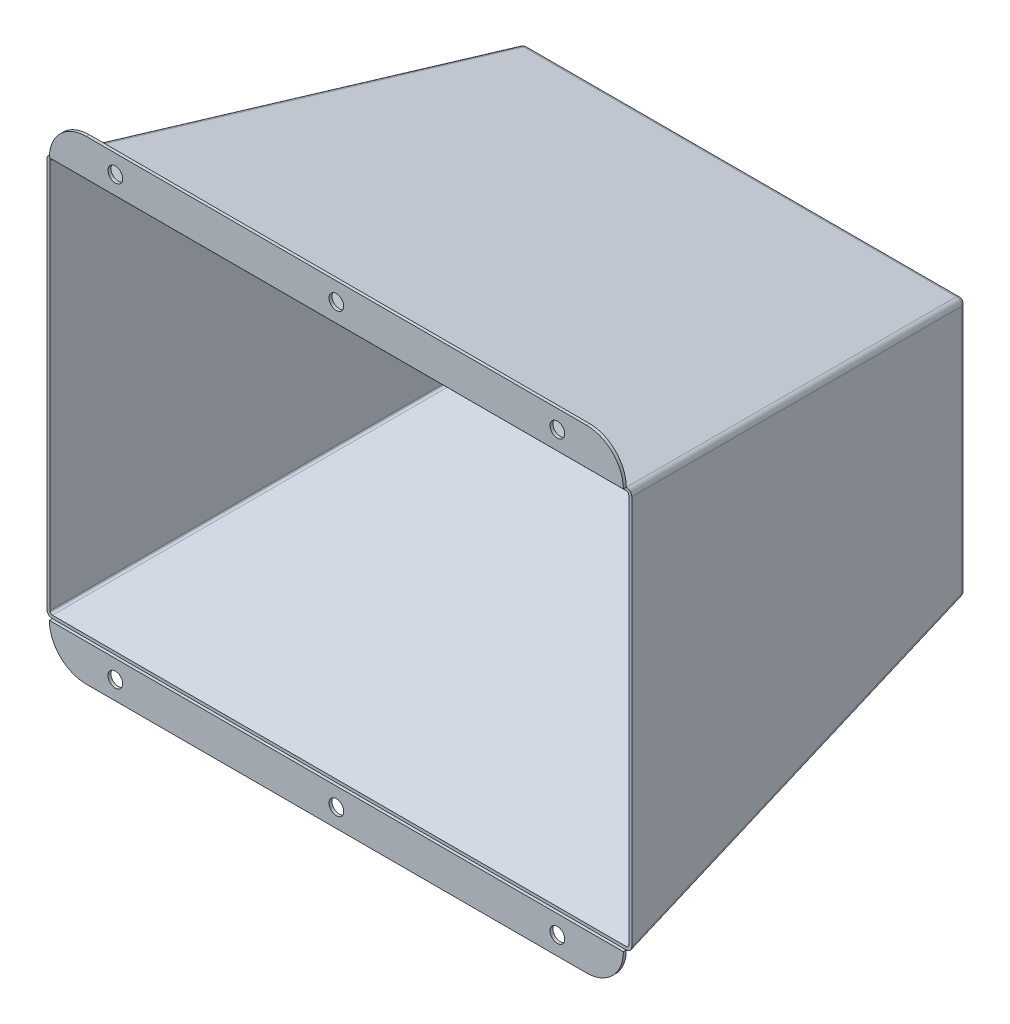
from build123d import *

# Parameters (mm, degrees)
CROQUIS1_W                = 240
CROQUIS1_H                = 140
SALIENTE_EXTRUIR1_DEPTH   = 220
SALIENTE_EXTRUIR1_DRAFT   = -10
REDONDEO1_R               = 3
VACIADO1_T                = -1.6
CROQUIS2_W                = 311.675024994
CROQUIS2_H                = 20
SALIENTE_EXTRUIR2_DEPTH   = 1.6
SALIENTE_EXTRUIR2_2_DEPTH = 1.6
REDONDEO2_R               = 20
REDONDEO3_R               = 20
CROQUIS3_R                = 4
CORTAR_EXTRUIR1_DEPTH     = 302.510864774
CROQUIS4_R                = 9
CROQUIS4_R_2              = 3.25
CORTAR_EXTRUIR2_DEPTH     = 302.510864774


with BuildPart() as part:
    # Croquis1 → Saliente-Extruir1 (with draft: the straight prism first)
    with BuildSketch(Plane.XY):
        Rectangle(CROQUIS1_W, CROQUIS1_H)
    extrude(amount=SALIENTE_EXTRUIR1_DEPTH)
    # Saliente-Extruir1: the draft: its side faces are tilted about the plane it starts from
    saliente_extruir1_sides = [part.faces().sort_by_distance(p)[0] for p in [
        (-120, 0, 110),
        (0, -70, 110),
        (120, 0, 110),
        (0, 70, 110),
    ]]
    draft(saliente_extruir1_sides, Plane.XY, SALIENTE_EXTRUIR1_DRAFT)

    # Redondeo1
    redondeo1_edges = [part.edges().sort_by_distance(p)[0] for p in [
        (0, -70, 0),
        (-120, 0, 0),
        (0, 70, 0),
        (120, 0, 0),
        (139.395967878, -89.395967878, 110),
        (-139.395967878, -89.395967878, 110),
        (-139.395967878, 89.395967878, 110),
        (139.395967878, 89.395967878, 110),
    ]]
    fillet(redondeo1_edges, radius=REDONDEO1_R)

    # Vaciado1
    vaciado1_openings = [part.faces().sort_by_distance(p)[0] for p in [
        (0, 0, 220),
    ]]
    offset(amount=VACIADO1_T, openings=vaciado1_openings, kind=Kind.INTERSECTION)

    # Croquis4 → Cortar-Extruir2 (cut, through all)
    with BuildSketch(Plane(origin=(0, 0, 0), x_dir=(-1, 0, 0), z_dir=(0, 0, -1))):
        Circle(CROQUIS4_R)
        with Locations((50, 0)):
            Circle(CROQUIS4_R_2)
        with Locations((35.355339059, -35.355339059)):
            Circle(CROQUIS4_R_2)
        with Locations((0, -50)):
            Circle(CROQUIS4_R_2)
        with Locations((-35.355339059, -35.355339059)):
            Circle(CROQUIS4_R_2)
        with Locations((-50, 0)):
            Circle(CROQUIS4_R_2)
        with Locations((-35.355339059, 35.355339059)):
            Circle(CROQUIS4_R_2)
        with Locations((0, 50)):
            Circle(CROQUIS4_R_2)
        with Locations((35.355339059, 35.355339059)):
            Circle(CROQUIS4_R_2)
    extrude(amount=-CORTAR_EXTRUIR2_DEPTH, mode=Mode.SUBTRACT)


with BuildPart() as body_2:
    # Croquis2 → Saliente-Extruir2 (new body)
    with BuildSketch(Plane.XY.offset(220)):
        with Locations((0, 118.791935756)):
            Rectangle(CROQUIS2_W, CROQUIS2_H)
    extrude(amount=SALIENTE_EXTRUIR2_DEPTH)

    # Redondeo2
    redondeo2_edges = [body_2.edges().sort_by_distance(p)[0] for p in [
        (-155.837512497, 128.791935756, 220.8),
        (155.837512497, 128.791935756, 220.8),
    ]]
    fillet(redondeo2_edges, radius=REDONDEO2_R - 0.0001)  # a hair under: the kernel refuses the full size


with BuildPart() as body_3:
    # Croquis2 → Saliente-Extruir2 2 (new body)
    with BuildSketch(Plane.XY.offset(220)):
        with Locations((0, -118.791935756)):
            Rectangle(CROQUIS2_W, CROQUIS2_H)
    extrude(amount=SALIENTE_EXTRUIR2_2_DEPTH)

    # Redondeo3
    redondeo3_edges = [body_3.edges().sort_by_distance(p)[0] for p in [
        (-155.837512497, -128.791935756, 220.8),
        (155.837512497, -128.791935756, 220.8),
    ]]
    fillet(redondeo3_edges, radius=REDONDEO3_R - 0.0001)  # a hair under: the kernel refuses the full size


with BuildPart() as cortar_extruir1_tool:
    # Croquis3 → Cortar-Extruir1 (new, through all)
    with BuildSketch(Plane.XY.offset(221.6)):
        with Locations((0, 118.791935756)):
            Circle(CROQUIS3_R)
        with Locations((120, 118.791935756)):
            Circle(CROQUIS3_R)
        with Locations(Location((-120, 118.791935756, 0), (0, 0, 180))):
            Circle(CROQUIS3_R)
        with Locations((120, -118.791935756)):
            Circle(CROQUIS3_R)
        with Locations((0, -118.791935756)):
            Circle(CROQUIS3_R)
        with Locations((-120, -118.791935756)):
            Circle(CROQUIS3_R)
    extrude(amount=-CORTAR_EXTRUIR1_DEPTH)


with BuildPart() as body_2_1:
    add(body_2.part)

    # Cortar-Extruir1: cut by cortar_extruir1_tool
    add(cortar_extruir1_tool.part, mode=Mode.SUBTRACT)


with BuildPart() as body_3_1:
    add(body_3.part)

    # Cortar-Extruir1: cut by cortar_extruir1_tool
    add(cortar_extruir1_tool.part, mode=Mode.SUBTRACT)


solid = Compound([part.part, body_2_1.part, body_3_1.part])
